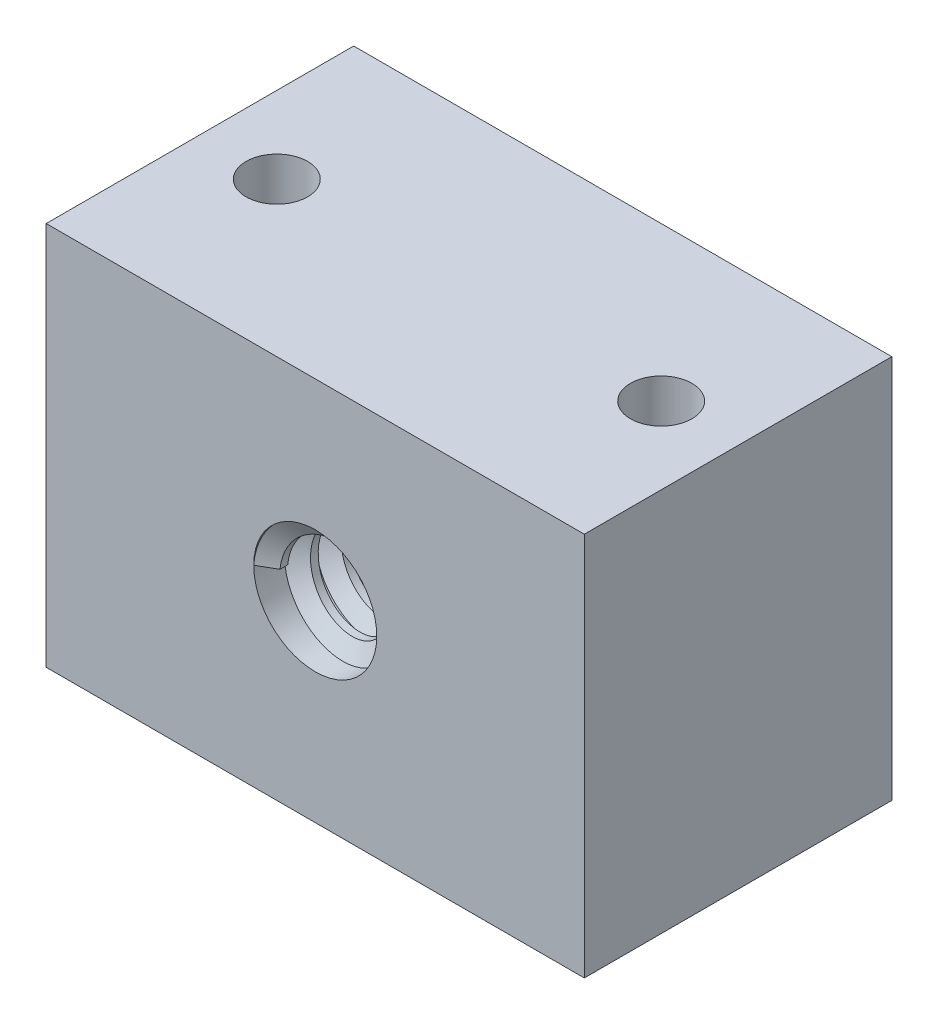
from build123d import *
from build123d.topology import SkipClean

# Parameters (mm, degrees)
SKETCH1_W           = 35
SKETCH1_H           = 25
BOSS_EXTRUDE1_DEPTH = 20
SKETCH2_R           = 4
CUT_EXTRUDE1_DEPTH  = 30.368350311
SKETCH3_R           = 2
CUT_EXTRUDE2_DEPTH  = 37.486298798
THREAD1_PITCH       = 2


with BuildPart() as part:
    # Sketch1 → Boss-Extrude1 (new body)
    with BuildSketch(Plane.XY):
        Rectangle(SKETCH1_W, SKETCH1_H)
    extrude(amount=BOSS_EXTRUDE1_DEPTH)

    # Sketch2 → Cut-Extrude1 (cut, through all)
    with BuildSketch(Plane.XY.offset(20)):
        Circle(SKETCH2_R)
    extrude(amount=-CUT_EXTRUDE1_DEPTH, mode=Mode.SUBTRACT)

    # Sketch3 → Cut-Extrude2 (cut, through all)
    with BuildSketch(Plane(origin=(0, 12.5, 0), x_dir=(1, 0, 0), z_dir=(0, 1, 0))):
        with Locations(Location((12.5, -10, 0), (0, 0, 270))):
            Circle(SKETCH3_R)
        with Locations(Location((-12.5, -10, 0), (0, 0, 90))):
            Circle(SKETCH3_R)
    extrude(amount=-CUT_EXTRUDE2_DEPTH, mode=Mode.SUBTRACT)

    # Thread1: the profile of Thread Profile1 profile screwed along a right-hand helix of 9 turns, 10 arcs to a turn; built about Z, then put on its axis
    with SkipClean():  # the faces are left unmerged after this step: merging them gives an invalid solid
        thread1_z = Axis((0, 0, 0), (0, 0, 1))
        thread1_corners = [(4.0003, 0, -0.000173205), (4.0003, 0, 1.7501732), (2.91746825, 0, 1.124999997), (2.91746825, 0, 0.624999997)]
        with BuildLine(mode=Mode.PRIVATE) as thread1_profile:
            Line(thread1_corners[0], thread1_corners[1])
            Line(thread1_corners[1], thread1_corners[2])
            Line(thread1_corners[2], thread1_corners[3])
            Line(thread1_corners[3], thread1_corners[0])
        thread1_cap = Face(thread1_profile.wire())
        thread1_turn_angles = [0, 18, 36, 54, 72, 90, 108, 126, 144, 162, 180, 198, 216, 234, 252, 270, 288, 306, 324, 342, 360]
        thread1_turn_weights = [1, 0.9510565162951535, 1, 0.9510565162951535, 1, 0.9510565162951535, 1, 0.9510565162951535, 1, 0.9510565162951535, 1, 0.9510565162951535, 1, 0.9510565162951535, 1, 0.9510565162951535, 1, 0.9510565162951535, 1, 0.9510565162951535, 1]
        thread1_turn_rails = [Edge.make_bspline([Vector(p[0], p[1], 0).rotate(thread1_z, thread1_turn_angles[k]) / thread1_turn_weights[k] + Vector(0, 0, p[2] + THREAD1_PITCH * thread1_turn_angles[k] / 360) for k in range(21)], [0, 0, 0, 1, 1, 2, 2, 3, 3, 4, 4, 5, 5, 6, 6, 7, 7, 8, 8, 9, 9, 10, 10, 10], 2, thread1_turn_weights) for p in thread1_corners]
        thread1_turn_sides = [Face.make_surface_from_curves(thread1_turn_rails[p[0]], thread1_turn_rails[p[1]]) for p in [(0, 1), (1, 2), (2, 3), (3, 0)]]
        thread1 = Plane(origin=(0, 0, 20), x_dir=(-1, 0, 0), z_dir=(0, 0, -1)) * Solid(Shell([*[p.moved(Location((0, 0, THREAD1_PITCH * i))) for i in range(9) for p in thread1_turn_sides], thread1_cap, thread1_cap.rotate(thread1_z, 3240).moved(Location((0, 0, THREAD1_PITCH * 3240 / 360)))]))
        add(thread1)


solid = part.part
